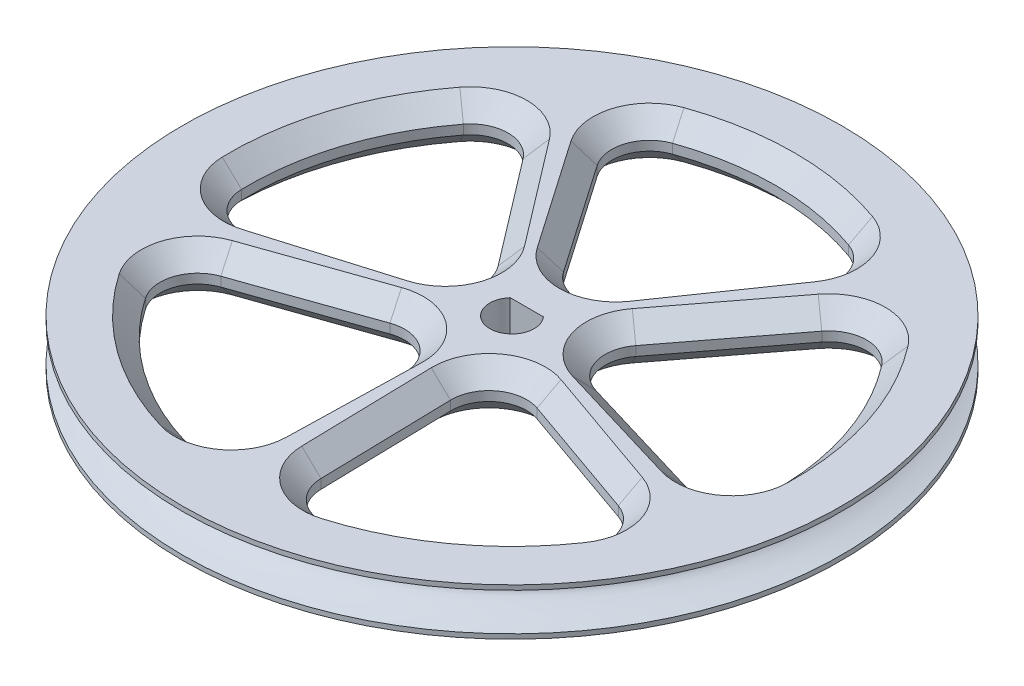
from build123d import *

# Parameters (mm, degrees)
SKETCH1_R           = 22.225
BOSS_EXTRUDE1_DEPTH = 3.175
CUT_EXTRUDE2_DEPTH  = 32.590851128
CHAMFER2_SIZE       = 1.27
CUT_EXTRUDE4_DEPTH  = 3.175


with BuildPart() as part:
    # Sketch1 → Boss-Extrude1 (new body)
    with BuildSketch(Plane(origin=(0, 0, 0), x_dir=(1, 0, 0), z_dir=(0, 1, 0))):
        Circle(SKETCH1_R)
    extrude(amount=BOSS_EXTRUDE1_DEPTH)

    # Sketch3 → Cut-Extrude2 (cut, through all)
    with BuildSketch(Plane(origin=(0, 3.175, 0), x_dir=(1, 0, 0), z_dir=(0, 1, 0))):
        with BuildLine():
            Line((-7.177442867, 12.920997753), (-2.08925331, 5.561763366))
            ThreePointArc((-2.08925331, 5.561763366), (0, 4.466277335), (2.08925331, 5.561763366))
            Line((2.08925331, 5.561763366), (7.177442867, 12.920997753))
            ThreePointArc((7.177442867, 12.920997753), (7.504993563, 15.146958071), (5.93622115, 16.759763675))
            ThreePointArc((5.93622115, 16.759763675), (0, 17.78), (-5.93622115, 16.759763675))
            ThreePointArc((-5.93622115, 16.759763675), (-7.504993563, 15.146958071), (-7.177442867, 12.920997753))
        make_face()
        with BuildLine():
            Line((10.070647287, 10.818961699), (4.643936513, 3.705677373))
            ThreePointArc((4.643936513, 3.705677373), (4.247682163, 1.380155598), (5.935166069, -0.268318576))
            Line((5.935166069, -0.268318576), (14.506550932, -2.83334592))
            ThreePointArc((14.506550932, -2.83334592), (16.72478373, -2.457005576), (17.773875673, -0.46663001))
            ThreePointArc((17.773875673, -0.46663001), (16.90978486, 5.49432216), (14.105089237, 10.824733605))
            ThreePointArc((14.105089237, 10.824733605), (12.086442622, 11.81834049), (10.070647287, 10.818961699))
        make_face()
        with BuildLine():
            Line((13.40144518, -6.2345117), (4.959363916, -3.271528798))
            ThreePointArc((4.959363916, -3.271528798), (2.62521195, -3.613294265), (1.57888105, -5.727593365))
            Line((1.57888105, -5.727593365), (1.788098668, -14.672101833))
            ThreePointArc((1.788098668, -14.672101833), (2.831491236, -16.665471028), (5.048638127, -17.048156882))
            ThreePointArc((5.048638127, -17.048156882), (10.450821786, -14.38432216), (14.653645713, -10.069710389))
            ThreePointArc((14.653645713, -10.069710389), (14.974825907, -7.842821958), (13.40144518, -6.2345117))
        make_face()
        with BuildLine():
            Line((-1.788098668, -14.672101833), (-1.57888105, -5.727593365))
            ThreePointArc((-1.57888105, -5.727593365), (-2.62521195, -3.613294265), (-4.959363916, -3.271528798))
            Line((-4.959363916, -3.271528798), (-13.40144518, -6.2345117))
            ThreePointArc((-13.40144518, -6.2345117), (-14.974825907, -7.842821958), (-14.653645713, -10.069710389))
            ThreePointArc((-14.653645713, -10.069710389), (-10.450821786, -14.38432216), (-5.048638127, -17.048156882))
            ThreePointArc((-5.048638127, -17.048156882), (-2.831491236, -16.665471028), (-1.788098668, -14.672101833))
        make_face()
        with BuildLine():
            Line((-14.506550932, -2.83334592), (-5.935166069, -0.268318576))
            ThreePointArc((-5.935166069, -0.268318576), (-4.247682163, 1.380155598), (-4.643936513, 3.705677373))
            Line((-4.643936513, 3.705677373), (-10.070647287, 10.818961699))
            ThreePointArc((-10.070647287, 10.818961699), (-12.086442622, 11.81834049), (-14.105089237, 10.824733605))
            ThreePointArc((-14.105089237, 10.824733605), (-16.90978486, 5.49432216), (-17.773875673, -0.46663001))
            ThreePointArc((-17.773875673, -0.46663001), (-16.72478373, -2.457005576), (-14.506550932, -2.83334592))
        make_face()
    extrude(amount=-CUT_EXTRUDE2_DEPTH, mode=Mode.SUBTRACT)

    # Chamfer2
    chamfer2_edges = [part.edges().sort_by_distance(p)[0] for p in [
        (0, 3.175, -4.466277335),
        (4.633348089, 3.175, -9.241380559),
        (7.504993563, 3.175, -15.146958071),
        (-4.633348089, 3.175, -9.241380559),
        (-7.504993563, 3.175, -15.146958071),
        (0, 3.175, -17.78),
        (-4.633348089, 0, -9.241380559),
        (-7.504993563, 0, -15.146958071),
        (0, 0, -17.78),
        (7.504993563, 0, -15.146958071),
        (4.633348089, 0, -9.241380559),
        (0, 0, -4.466277335),
        (7.3572919, 0, -7.262319536),
        (12.086442622, 0, -11.81834049),
        (16.90978486, 0, -5.49432216),
        (16.72478373, 0, 2.457005576),
        (10.2208585, 0, 1.550832248),
        (4.247682163, 0, -1.380155598),
        (7.3572919, 3.175, -7.262319536),
        (12.086442622, 3.175, -11.81834049),
        (16.90978486, 3.175, -5.49432216),
        (16.72478373, 3.175, 2.457005576),
        (10.2208585, 3.175, 1.550832248),
        (4.247682163, 3.175, -1.380155598),
        (9.180404548, 0, 4.753020249),
        (14.974825907, 0, 7.842821958),
        (10.450821786, 0, 14.38432216),
        (2.831491236, 0, 16.665471028),
        (1.683489859, 0, 10.199847599),
        (2.62521195, 0, 3.613294265),
        (9.180404548, 3.175, 4.753020249),
        (14.974825907, 3.175, 7.842821958),
        (10.450821786, 3.175, 14.38432216),
        (2.831491236, 3.175, 16.665471028),
        (1.683489859, 3.175, 10.199847599),
        (2.62521195, 3.175, 3.613294265),
        (-1.683489859, 0, 10.199847599),
        (-2.831491236, 0, 16.665471028),
        (-10.450821786, 0, 14.38432216),
        (-14.974825907, 0, 7.842821958),
        (-9.180404548, 0, 4.753020249),
        (-2.62521195, 0, 3.613294265),
        (-1.683489859, 3.175, 10.199847599),
        (-2.831491236, 3.175, 16.665471028),
        (-10.450821786, 3.175, 14.38432216),
        (-14.974825907, 3.175, 7.842821958),
        (-9.180404548, 3.175, 4.753020249),
        (-2.62521195, 3.175, 3.613294265),
        (-10.2208585, 0, 1.550832248),
        (-16.72478373, 0, 2.457005576),
        (-16.90978486, 0, -5.49432216),
        (-12.086442622, 0, -11.81834049),
        (-7.3572919, 0, -7.262319536),
        (-4.247682163, 0, -1.380155598),
        (-10.2208585, 3.175, 1.550832248),
        (-16.72478373, 3.175, 2.457005576),
        (-16.90978486, 3.175, -5.49432216),
        (-12.086442622, 3.175, -11.81834049),
        (-7.3572919, 3.175, -7.262319536),
        (-4.247682163, 3.175, -1.380155598),
    ]]
    chamfer(chamfer2_edges, length=CHAMFER2_SIZE)

    # Sketch6 → Cut-Revolve3 (revolve, cut)
    with BuildSketch(Plane(origin=(0, 0, 0), x_dir=(0, 0, -1), z_dir=(1, 0, 0))):
        with BuildLine():
            Line((-22.225, 2.8575), (-22.225, 0.3175))
            add(Edge.make_bspline(
                [(-22.225, 2.8575), (-18.161, 1.5875), (-22.225, 0.3175)],
                knots=[0, 0, 0, 1, 1, 1], degree=2))
        make_face()
    revolve(axis=Axis((0, 5.876661269, 0), (0, -1, 0)), mode=Mode.SUBTRACT)

    # Sketch2 → Cut-Extrude4 (cut)
    with BuildSketch(Plane(origin=(0, 3.175, 0), x_dir=(1, 0, 0), z_dir=(0, 1, 0))):
        with BuildLine():
            Line((-1.118033989, 1), (1.118033989, 1))
            ThreePointArc((1.118033989, 1), (0, -1.5), (-1.118033989, 1))
        make_face()
    extrude(amount=-CUT_EXTRUDE4_DEPTH, mode=Mode.SUBTRACT)


solid = part.part
